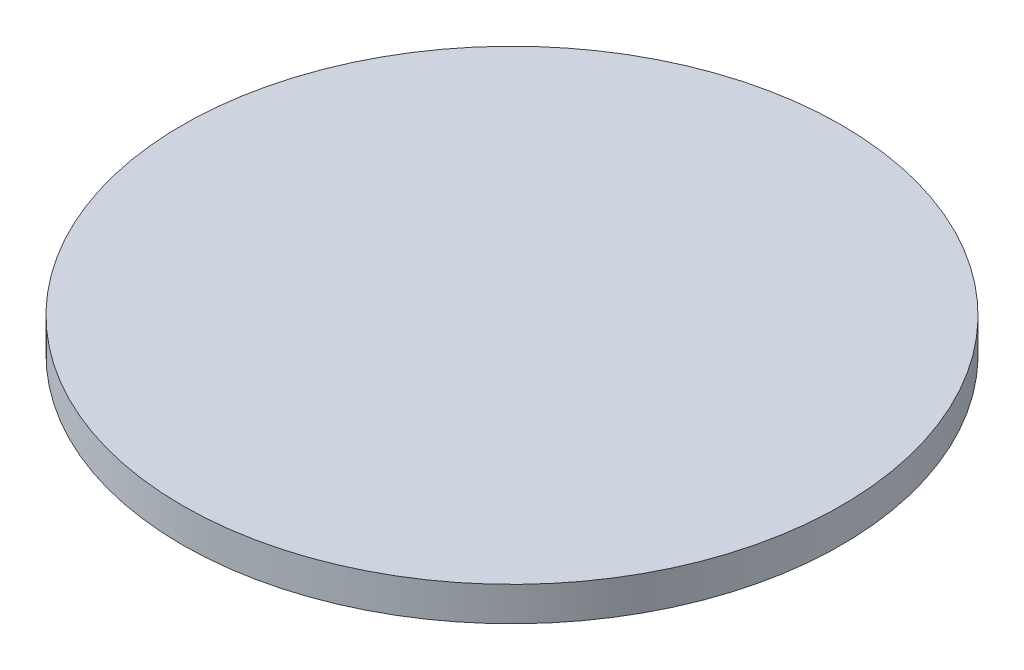
from build123d import *

# Parameters (mm, degrees)
SKETCH1_R           = 22.21
BOSS_EXTRUDE1_DEPTH = 2.3


with BuildPart() as part:
    # Sketch1 → Boss-Extrude1 (new body)
    with BuildSketch(Plane(origin=(0, 0, 0), x_dir=(1, 0, 0), z_dir=(0, 1, 0))):
        Circle(SKETCH1_R)
    extrude(amount=BOSS_EXTRUDE1_DEPTH)


solid = part.part
